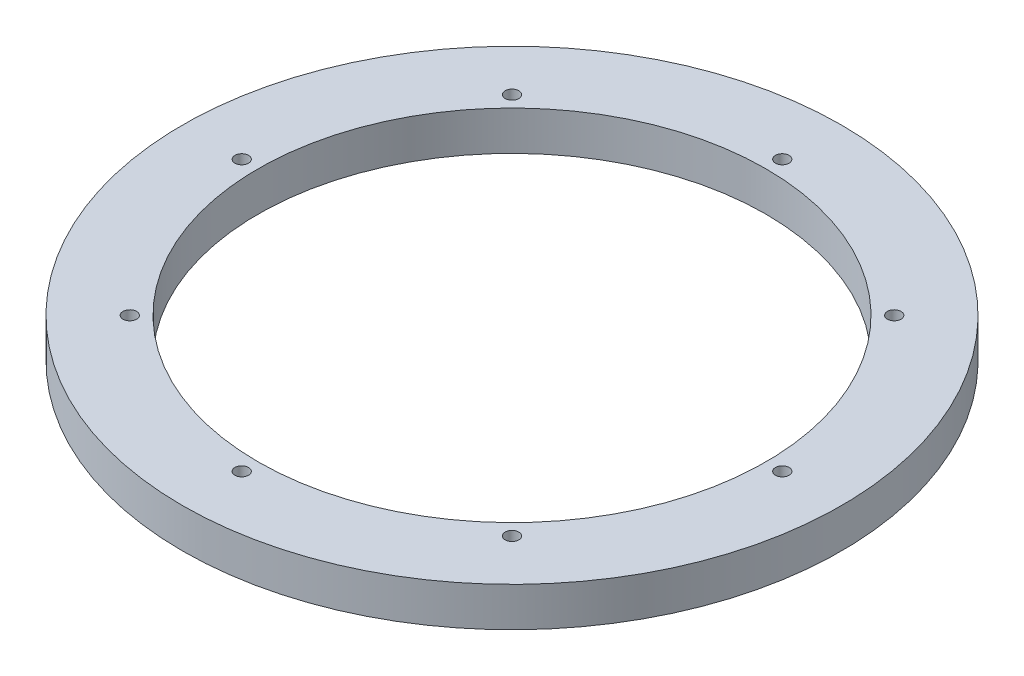
from build123d import *

# Parameters (mm, degrees)
SKETCH1_R           = 63.881
SKETCH1_R_2         = 1.3208
SKETCH1_R_3         = 49.2125
BOSS_EXTRUDE1_DEPTH = 7.62


with BuildPart() as part:
    # Sketch1 → Boss-Extrude1 (new body)
    with BuildSketch(Plane(origin=(0, 0, 0), x_dir=(1, 0, 0), z_dir=(0, 1, 0))):
        Circle(SKETCH1_R)
        with Locations((-37.043556499, -37.043556499)):
            Circle(SKETCH1_R_2, mode=Mode.SUBTRACT)
        with Locations((0, -52.3875)):
            Circle(SKETCH1_R_2, mode=Mode.SUBTRACT)
        Circle(SKETCH1_R_3, mode=Mode.SUBTRACT)
        with Locations((37.043556499, -37.043556499)):
            Circle(SKETCH1_R_2, mode=Mode.SUBTRACT)
        with Locations((52.3875, 0)):
            Circle(SKETCH1_R_2, mode=Mode.SUBTRACT)
        with Locations((-52.3875, 0)):
            Circle(SKETCH1_R_2, mode=Mode.SUBTRACT)
        with Locations((-37.043556499, 37.043556499)):
            Circle(SKETCH1_R_2, mode=Mode.SUBTRACT)
        with Locations((0, 52.3875)):
            Circle(SKETCH1_R_2, mode=Mode.SUBTRACT)
        with Locations((37.043556499, 37.043556499)):
            Circle(SKETCH1_R_2, mode=Mode.SUBTRACT)
    extrude(amount=BOSS_EXTRUDE1_DEPTH)


solid = part.part
